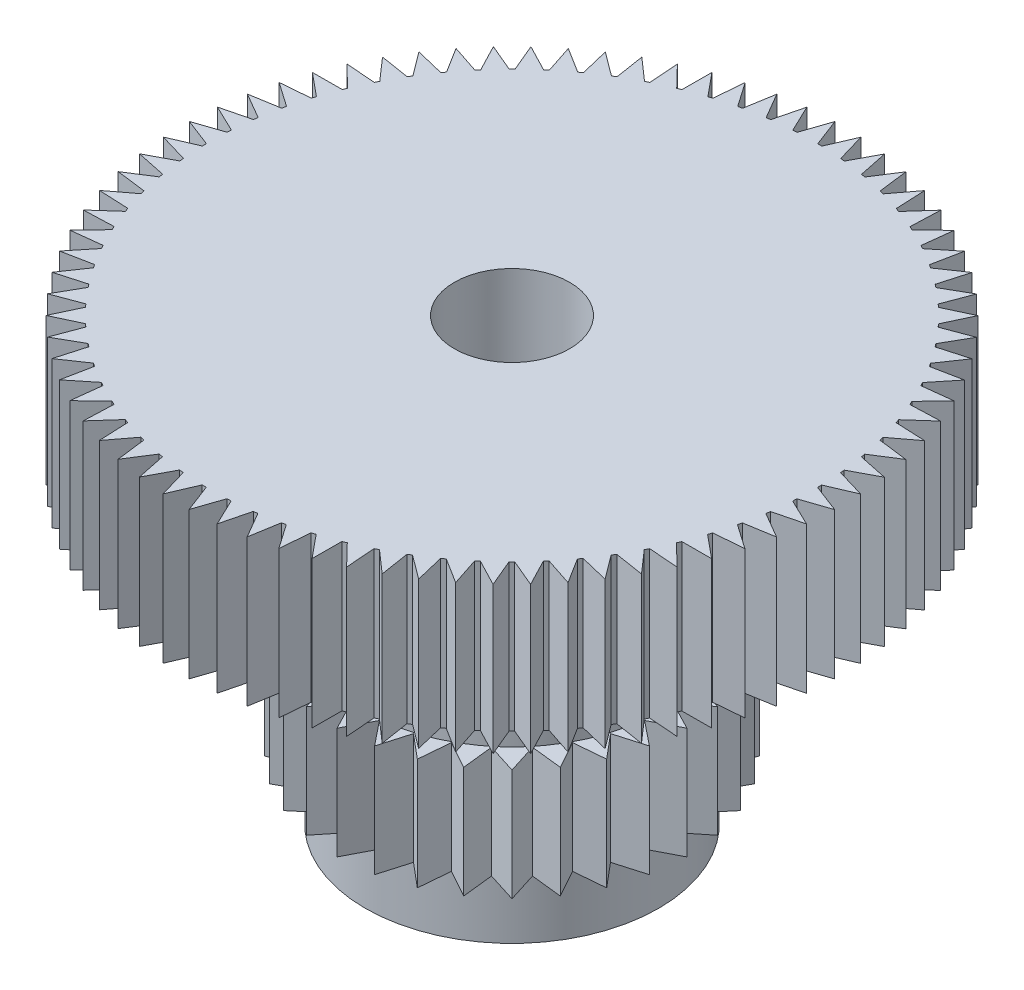
from build123d import *

# Parameters (mm, degrees)
SKETCH1_R           = 6.35
BOSS_EXTRUDE1_DEPTH = 12.7
SKETCH2_R           = 14.2875
BOSS_EXTRUDE2_DEPTH = 6.35
SKETCH3_R           = 2.494308135
CUT_EXTRUDE1_DEPTH  = 27.432
CUT_EXTRUDE5_START  = -7.366
SKETCH4_R           = 14.2875
CUT_EXTRUDE5_DEPTH  = 7.366
BOSS_EXTRUDE3_START = -2.54
SKETCH5_R           = 6.35
BOSS_EXTRUDE3_DEPTH = 4.826


with BuildPart() as part:
    # Sketch1 → Boss-Extrude1 (new body)
    with BuildSketch(Plane(origin=(0, 0, 0), x_dir=(1, 0, 0), z_dir=(0, 1, 0))):
        with Locations(Location((0, 0, 0), (0, 0, 270))):
            Circle(SKETCH1_R)
    extrude(amount=BOSS_EXTRUDE1_DEPTH)

    # Sketch2 → Boss-Extrude2 (add)
    with BuildSketch(Plane(origin=(0, 12.7, 0), x_dir=(1, 0, 0), z_dir=(0, 1, 0))):
        with Locations(Location((0, 0, 0), (0, 0, 270))):
            Circle(SKETCH2_R)
    extrude(amount=BOSS_EXTRUDE2_DEPTH)

    # Sketch3 → Cut-Extrude1 (cut)
    with BuildSketch(Plane.XZ):
        with Locations(Location((0, 0, 0), (0, 0, 270))):
            Circle(SKETCH3_R)
    extrude(amount=-CUT_EXTRUDE1_DEPTH, mode=Mode.SUBTRACT)

    # Sketch4 → Cut-Extrude5 (cut)
    with BuildSketch(Plane(origin=(0, 19.05, 0), x_dir=(1, 0, 0), z_dir=(0, 1, 0)).offset(CUT_EXTRUDE5_START)):
        Circle(SKETCH4_R)
        with BuildLine():
            Line((-0.695868842, 13.040502027), (-0.282374093, 14.260621109))
            Line((-0.282374093, 14.260621109), (0.179096678, 13.057827191))
            ThreePointArc((0.179096678, 13.057827191), (0.267410505, 13.056317176), (0.355712099, 13.054209875))
            Line((0.355712099, 13.054209875), (0.866044808, 14.237099983))
            Line((0.866044808, 14.237099983), (1.229234471, 13.001073386))
            ThreePointArc((1.229234471, 13.001073386), (1.317140418, 12.992461956), (1.40498611, 12.983256163))
            Line((1.40498611, 12.983256163), (2.008847076, 14.121245801))
            Line((2.008847076, 14.121245801), (2.271400208, 12.860002631))
            ThreePointArc((2.271400208, 12.860002631), (2.35832817, 12.844345636), (2.445148247, 12.828101053))
            Line((2.445148247, 12.828101053), (3.138621199, 13.913809921))
            Line((3.138621199, 13.913809921), (3.298835042, 12.635529824))
            ThreePointArc((3.298835042, 12.635529824), (3.38422126, 12.612928805), (3.46945266, 12.589750784))
            Line((3.46945266, 12.589750784), (4.24804016, 13.616137644))
            Line((4.24804016, 13.616137644), (4.304875665, 12.329110758))
            ThreePointArc((4.304875665, 12.329110758), (4.388166375, 12.299712291), (4.47125634, 12.269751151))
            Line((4.47125634, 12.269751151), (5.32990895, 13.23015949))
            Line((5.32990895, 13.23015949), (5.282997518, 11.942732677))
            ThreePointArc((5.282997518, 11.942732677), (5.363652548, 11.906727422), (5.444062208, 11.870177473))
            Line((5.444062208, 11.870177473), (6.377211235, 12.758378675))
            Line((6.377211235, 12.758378675), (6.226857105, 11.478901392))
            ThreePointArc((6.226857105, 11.478901392), (6.304353376, 11.436522858), (6.381561243, 11.393621139))
            Line((6.381561243, 11.393621139), (7.383154859, 12.203854878))
            Line((7.383154859, 12.203854878), (7.130333133, 10.940625027))
            ThreePointArc((7.130333133, 10.940625027), (7.204168053, 10.892148054), (7.277673405, 10.843172801))
            Line((7.277673405, 10.843172801), (8.341215889, 11.570184399))
            Line((8.341215889, 11.570184399), (7.987566216, 10.33139451))
            ThreePointArc((7.987566216, 10.33139451), (8.057260936, 10.277133491), (8.126587061, 10.222402325))
            Line((8.126587061, 10.222402325), (9.245180935, 10.861476835))
            Line((9.245180935, 10.861476835), (8.792996866, 9.655160935))
            ThreePointArc((8.792996866, 9.655160935), (8.858099389, 9.595467773), (8.922796683, 9.535335648))
            Line((8.922796683, 9.535335648), (10.089187434, 10.082328425))
            Line((10.089187434, 10.082328425), (9.541401557, 8.916309937))
            ThreePointArc((9.541401557, 8.916309937), (9.601489669, 8.851571764), (9.661138544, 8.78642866))
            Line((9.661138544, 8.78642866), (10.867761681, 9.237792247))
            Line((10.867761681, 9.237792247), (10.227926598, 8.119633247))
            ThreePointArc((10.227926598, 8.119633247), (10.282610605, 8.050269916), (10.336824214, 7.980538311))
            Line((10.336824214, 7.980538311), (11.575854323, 8.333345441))
            Line((11.575854323, 8.333345441), (10.848119611, 7.27029762))
            ThreePointArc((10.848119611, 7.27029762), (10.897044864, 7.196758979), (10.945471613, 7.122891109))
            Line((10.945471613, 7.122891109), (12.208873108, 7.374853692))
            Line((12.208873108, 7.374853692), (11.397958404, 6.373811323))
            ThreePointArc((11.397958404, 6.373811323), (11.440807606, 6.296574297), (11.483133428, 6.219049224))
            Line((11.483133428, 6.219049224), (12.762712666, 6.368533187))
            Line((12.762712666, 6.368533187), (11.873877064, 5.435988413))
            ThreePointArc((11.873877064, 5.435988413), (11.910372321, 5.355553916), (11.946322716, 5.274874418))
            Line((11.946322716, 5.274874418), (13.233781134, 5.320910301))
            Line((13.233781134, 5.320910301), (12.272789075, 4.462911033))
            ThreePointArc((12.272789075, 4.462911033), (12.302693701, 4.379800712), (12.332035517, 4.296490028))
            Line((12.332035517, 4.296490028), (13.619023454, 4.238779269))
            Line((13.619023454, 4.238779269), (12.592107339, 3.460889963))
            ThreePointArc((12.592107339, 3.460889963), (12.615227391, 3.37564282), (12.637770336, 3.290241252))
            Line((12.637770336, 3.290241252), (13.915941181, 3.129158127))
            Line((13.915941181, 3.129158127), (12.829760955, 2.436423692))
            ThreePointArc((12.829760955, 2.436423692), (12.84594649, 2.349592588), (12.861544365, 2.262653998))
            Line((12.861544365, 2.262653998), (14.122608689, 1.999243195))
            Line((14.122608689, 1.999243195), (12.984208648, 1.39615628))
            ThreePointArc((12.984208648, 1.39615628), (12.993354698, 1.308304348), (13.001906343, 1.220392565))
            Line((13.001906343, 1.220392565), (14.237685661, 0.856362402))
            Line((14.237685661, 0.856362402), (13.054448765, 0.346834258))
            ThreePointArc((13.054448765, 0.346834258), (13.056496014, 0.258531251), (13.057945969, 0.170216418))
            Line((13.057945969, 0.170216418), (14.260425778, -0.292072229))
            Line((14.260425778, -0.292072229), (13.040025773, -0.704737118))
            ThreePointArc((13.040025773, -0.704737118), (13.034960943, -0.79291852), (13.029299805, -0.881063648))
            Line((13.029299805, -0.881063648), (14.190681561, -1.438612659))
            Line((14.190681561, -1.438612659), (12.94103321, -1.751738002))
            ThreePointArc((12.94103321, -1.751738002), (12.928889149, -1.83922591), (12.916153632, -1.926629679))
            Line((12.916153632, -1.926629679), (14.028905329, -2.575823135))
            Line((14.028905329, -2.575823135), (12.75811308, -2.787378194))
            ThreePointArc((12.75811308, -2.787378194), (12.738968547, -2.873605214), (12.719241246, -2.959700776))
            Line((12.719241246, -2.959700776), (13.776146262, -3.696328409))
            Line((13.776146262, -3.696328409), (12.492451692, -3.804941168))
            ThreePointArc((12.492451692, -3.804941168), (12.466430846, -3.889348086), (12.4398397, -3.973577078))
            Line((12.4398397, -3.973577078), (13.434043601, -4.792861574))
            Line((13.434043601, -4.792861574), (12.14577196, -4.797827639))
            ThreePointArc((12.14577196, -4.797827639), (12.113043557, -4.879867043), (12.07976102, -4.961683208))
            Line((12.07976102, -4.961683208), (13.004816012, -5.858311194))
            Line((13.004816012, -5.858311194), (11.720322237, -5.759598356))
            ThreePointArc((11.720322237, -5.759598356), (11.681098532, -5.838738189), (11.641340455, -5.917610919))
            Line((11.641340455, -5.917610919), (12.491247201, -6.885767417))
            Line((12.491247201, -6.885767417), (11.218861727, -6.684015868))
            ThreePointArc((11.218861727, -6.684015868), (11.173397102, -6.759742878), (11.127421329, -6.835160652))
            Line((11.127421329, -6.835160652), (11.896667858, -7.868566796))
            Line((11.896667858, -7.868566796), (10.644642593, -7.565084972))
            ThreePointArc((10.644642593, -7.565084972), (10.593231903, -7.636908041), (10.541336606, -7.708381745))
            Line((10.541336606, -7.708381745), (11.224934059, -8.8003355))
            Line((11.224934059, -8.8003355), (10.001388867, -8.397091597))
            ThreePointArc((10.001388867, -8.397091597), (9.94436553, -8.464544924), (9.88688727, -8.531611024))
            Line((9.88688727, -8.531611024), (10.480402255, -9.675030652))
            Line((10.480402255, -9.675030652), (9.293272297, -9.174639861))
            ThreePointArc((9.293272297, -9.174639861), (9.231006131, -9.237285985), (9.168317677, -9.299509533))
            Line((9.168317677, -9.299509533), (9.667901021, -10.486979517))
            Line((9.667901021, -10.486979517), (8.524885289, -9.892687065))
            ThreePointArc((8.524885289, -9.892687065), (8.457780115, -9.950119702), (8.390288025, -10.007097153))
            Line((8.390288025, -10.007097153), (8.792699739, -11.230916295))
            Line((8.792699739, -11.230916295), (7.70121113, -10.546576397))
            ThreePointArc((7.70121113, -10.546576397), (7.62970215, -10.598423075), (7.557844135, -10.649784908))
            Line((7.557844135, -10.649784908), (7.860474426, -11.902016272))
            Line((7.860474426, -11.902016272), (6.827591661, -11.132067134))
            ThreePointArc((6.827591661, -11.132067134), (6.752142638, -11.177991607), (6.676384726, -11.223404722))
            Line((6.676384726, -11.223404722), (6.877270919, -12.495927106))
            Line((6.877270919, -12.495927106), (5.90969264, -11.645362144))
            ThreePointArc((5.90969264, -11.645362144), (5.83079289, -11.685066574), (5.751626401, -11.724236449))
            Line((5.751626401, -11.724236449), (5.849465671, -13.008797058))
            Line((5.849465671, -13.008797058), (4.953466994, -12.083132512))
            ThreePointArc((4.953466994, -12.083132512), (4.871628213, -12.1163594), (4.789566571, -12.149032004))
            Line((4.789566571, -12.149032004), (4.783724394, -13.437299969))
            Line((4.783724394, -13.437299969), (3.965116214, -12.442539129))
            ThreePointArc((3.965116214, -12.442539129), (3.880869158, -12.469072987), (3.796444563, -12.495036424))
            Line((3.796444563, -12.495036424), (3.686958829, -13.778656834))
            Line((3.686958829, -13.778656834), (2.951050135, -12.721251105))
            ThreePointArc((2.951050135, -12.721251105), (2.864941176, -12.74091985), (2.778701157, -12.760005739))
            Line((2.778701157, -12.760005739), (2.56628192, -14.030653821))
            Line((2.56628192, -14.030653821), (1.917845362, -12.917460886))
            ThreePointArc((1.917845362, -12.917460886), (1.830432952, -12.930136959), (1.742936806, -12.942221519))
            Line((1.742936806, -12.942221519), (1.428961689, -14.191656635))
            Line((1.428961689, -14.191656635), (0.872202627, -13.029895976))
            ThreePointArc((0.872202627, -13.029895976), (0.784053668, -13.035497168), (0.695868842, -13.040502027))
            Line((0.695868842, -13.040502027), (0.282374093, -14.260621109))
            Line((0.282374093, -14.260621109), (-0.179096678, -13.057827191))
            ThreePointArc((-0.179096678, -13.057827191), (-0.267410505, -13.056317176), (-0.355712099, -13.054209875))
            Line((-0.355712099, -13.054209875), (-0.866044808, -14.237099983))
            Line((-0.866044808, -14.237099983), (-1.229234471, -13.001073386))
            ThreePointArc((-1.229234471, -13.001073386), (-1.317140418, -12.992461956), (-1.40498611, -12.983256163))
            Line((-1.40498611, -12.983256163), (-2.008847076, -14.121245801))
            Line((-2.008847076, -14.121245801), (-2.271400208, -12.860002631))
            ThreePointArc((-2.271400208, -12.860002631), (-2.35832817, -12.844345636), (-2.445148247, -12.828101053))
            Line((-2.445148247, -12.828101053), (-3.138621199, -13.913809921))
            Line((-3.138621199, -13.913809921), (-3.298835042, -12.635529824))
            ThreePointArc((-3.298835042, -12.635529824), (-3.38422126, -12.612928805), (-3.46945266, -12.589750784))
            Line((-3.46945266, -12.589750784), (-4.24804016, -13.616137644))
            Line((-4.24804016, -13.616137644), (-4.304875665, -12.329110758))
            ThreePointArc((-4.304875665, -12.329110758), (-4.388166375, -12.299712291), (-4.47125634, -12.269751151))
            Line((-4.47125634, -12.269751151), (-5.32990895, -13.23015949))
            Line((-5.32990895, -13.23015949), (-5.282997518, -11.942732677))
            ThreePointArc((-5.282997518, -11.942732677), (-5.363652548, -11.906727422), (-5.444062208, -11.870177473))
            Line((-5.444062208, -11.870177473), (-6.377211235, -12.758378675))
            Line((-6.377211235, -12.758378675), (-6.226857105, -11.478901392))
            ThreePointArc((-6.226857105, -11.478901392), (-6.304353376, -11.436522858), (-6.381561243, -11.393621139))
            Line((-6.381561243, -11.393621139), (-7.383154859, -12.203854878))
            Line((-7.383154859, -12.203854878), (-7.130333133, -10.940625027))
            ThreePointArc((-7.130333133, -10.940625027), (-7.204168053, -10.892148054), (-7.277673405, -10.843172801))
            Line((-7.277673405, -10.843172801), (-8.341215889, -11.570184399))
            Line((-8.341215889, -11.570184399), (-7.987566216, -10.33139451))
            ThreePointArc((-7.987566216, -10.33139451), (-8.057260936, -10.277133491), (-8.126587061, -10.222402325))
            Line((-8.126587061, -10.222402325), (-9.245180935, -10.861476835))
            Line((-9.245180935, -10.861476835), (-8.792996866, -9.655160935))
            ThreePointArc((-8.792996866, -9.655160935), (-8.858099389, -9.595467773), (-8.922796683, -9.535335648))
            Line((-8.922796683, -9.535335648), (-10.089187434, -10.082328425))
            Line((-10.089187434, -10.082328425), (-9.541401557, -8.916309937))
            ThreePointArc((-9.541401557, -8.916309937), (-9.601489669, -8.851571764), (-9.661138544, -8.78642866))
            Line((-9.661138544, -8.78642866), (-10.867761681, -9.237792247))
            Line((-10.867761681, -9.237792247), (-10.227926598, -8.119633247))
            ThreePointArc((-10.227926598, -8.119633247), (-10.282610605, -8.050269916), (-10.336824214, -7.980538311))
            Line((-10.336824214, -7.980538311), (-11.575854323, -8.333345441))
            Line((-11.575854323, -8.333345441), (-10.848119611, -7.27029762))
            ThreePointArc((-10.848119611, -7.27029762), (-10.897044864, -7.196758979), (-10.945471613, -7.122891109))
            Line((-10.945471613, -7.122891109), (-12.208873108, -7.374853692))
            Line((-12.208873108, -7.374853692), (-11.397958404, -6.373811323))
            ThreePointArc((-11.397958404, -6.373811323), (-11.440807606, -6.296574297), (-11.483133428, -6.219049224))
            Line((-11.483133428, -6.219049224), (-12.762712666, -6.368533187))
            Line((-12.762712666, -6.368533187), (-11.873877064, -5.435988413))
            ThreePointArc((-11.873877064, -5.435988413), (-11.910372321, -5.355553916), (-11.946322716, -5.274874418))
            Line((-11.946322716, -5.274874418), (-13.233781134, -5.320910301))
            Line((-13.233781134, -5.320910301), (-12.272789075, -4.462911033))
            ThreePointArc((-12.272789075, -4.462911033), (-12.302693701, -4.379800712), (-12.332035517, -4.296490028))
            Line((-12.332035517, -4.296490028), (-13.619023454, -4.238779269))
            Line((-13.619023454, -4.238779269), (-12.592107339, -3.460889963))
            ThreePointArc((-12.592107339, -3.460889963), (-12.615227391, -3.37564282), (-12.637770336, -3.290241252))
            Line((-12.637770336, -3.290241252), (-13.915941181, -3.129158127))
            Line((-13.915941181, -3.129158127), (-12.829760955, -2.436423692))
            ThreePointArc((-12.829760955, -2.436423692), (-12.84594649, -2.349592588), (-12.861544365, -2.262653998))
            Line((-12.861544365, -2.262653998), (-14.122608689, -1.999243195))
            Line((-14.122608689, -1.999243195), (-12.984208648, -1.39615628))
            ThreePointArc((-12.984208648, -1.39615628), (-12.993354698, -1.308304348), (-13.001906343, -1.220392565))
            Line((-13.001906343, -1.220392565), (-14.237685661, -0.856362402))
            Line((-14.237685661, -0.856362402), (-13.054448765, -0.346834258))
            ThreePointArc((-13.054448765, -0.346834258), (-13.056496014, -0.258531251), (-13.057945969, -0.170216418))
            Line((-13.057945969, -0.170216418), (-14.260425778, 0.292072229))
            Line((-14.260425778, 0.292072229), (-13.040025773, 0.704737118))
            ThreePointArc((-13.040025773, 0.704737118), (-13.034960943, 0.79291852), (-13.029299805, 0.881063648))
            Line((-13.029299805, 0.881063648), (-14.190681561, 1.438612659))
            Line((-14.190681561, 1.438612659), (-12.94103321, 1.751738002))
            ThreePointArc((-12.94103321, 1.751738002), (-12.928889149, 1.83922591), (-12.916153632, 1.926629679))
            Line((-12.916153632, 1.926629679), (-14.028905329, 2.575823135))
            Line((-14.028905329, 2.575823135), (-12.75811308, 2.787378194))
            ThreePointArc((-12.75811308, 2.787378194), (-12.738968547, 2.873605214), (-12.719241246, 2.959700776))
            Line((-12.719241246, 2.959700776), (-13.776146262, 3.696328409))
            Line((-13.776146262, 3.696328409), (-12.492451692, 3.804941168))
            ThreePointArc((-12.492451692, 3.804941168), (-12.466430846, 3.889348086), (-12.4398397, 3.973577078))
            Line((-12.4398397, 3.973577078), (-13.434043601, 4.792861574))
            Line((-13.434043601, 4.792861574), (-12.14577196, 4.797827639))
            ThreePointArc((-12.14577196, 4.797827639), (-12.113043557, 4.879867043), (-12.07976102, 4.961683208))
            Line((-12.07976102, 4.961683208), (-13.004816012, 5.858311194))
            Line((-13.004816012, 5.858311194), (-11.720322237, 5.759598356))
            ThreePointArc((-11.720322237, 5.759598356), (-11.681098532, 5.838738189), (-11.641340455, 5.917610919))
            Line((-11.641340455, 5.917610919), (-12.491247201, 6.885767417))
            Line((-12.491247201, 6.885767417), (-11.218861727, 6.684015868))
            ThreePointArc((-11.218861727, 6.684015868), (-11.173397102, 6.759742878), (-11.127421329, 6.835160652))
            Line((-11.127421329, 6.835160652), (-11.896667858, 7.868566796))
            Line((-11.896667858, 7.868566796), (-10.644642593, 7.565084972))
            ThreePointArc((-10.644642593, 7.565084972), (-10.593231903, 7.636908041), (-10.541336606, 7.708381745))
            Line((-10.541336606, 7.708381745), (-11.224934059, 8.8003355))
            Line((-11.224934059, 8.8003355), (-10.001388867, 8.397091597))
            ThreePointArc((-10.001388867, 8.397091597), (-9.94436553, 8.464544924), (-9.88688727, 8.531611024))
            Line((-9.88688727, 8.531611024), (-10.480402255, 9.675030652))
            Line((-10.480402255, 9.675030652), (-9.293272297, 9.174639861))
            ThreePointArc((-9.293272297, 9.174639861), (-9.231006131, 9.237285985), (-9.168317677, 9.299509533))
            Line((-9.168317677, 9.299509533), (-9.667901021, 10.486979517))
            Line((-9.667901021, 10.486979517), (-8.524885289, 9.892687065))
            ThreePointArc((-8.524885289, 9.892687065), (-8.457780115, 9.950119702), (-8.390288025, 10.007097153))
            Line((-8.390288025, 10.007097153), (-8.792699739, 11.230916295))
            Line((-8.792699739, 11.230916295), (-7.70121113, 10.546576397))
            ThreePointArc((-7.70121113, 10.546576397), (-7.62970215, 10.598423075), (-7.557844135, 10.649784908))
            Line((-7.557844135, 10.649784908), (-7.860474426, 11.902016272))
            Line((-7.860474426, 11.902016272), (-6.827591661, 11.132067134))
            ThreePointArc((-6.827591661, 11.132067134), (-6.752142638, 11.177991607), (-6.676384726, 11.223404722))
            Line((-6.676384726, 11.223404722), (-6.877270919, 12.495927106))
            Line((-6.877270919, 12.495927106), (-5.90969264, 11.645362144))
            ThreePointArc((-5.90969264, 11.645362144), (-5.83079289, 11.685066574), (-5.751626401, 11.724236449))
            Line((-5.751626401, 11.724236449), (-5.849465671, 13.008797058))
            Line((-5.849465671, 13.008797058), (-4.953466994, 12.083132512))
            ThreePointArc((-4.953466994, 12.083132512), (-4.871628213, 12.1163594), (-4.789566571, 12.149032004))
            Line((-4.789566571, 12.149032004), (-4.783724394, 13.437299969))
            Line((-4.783724394, 13.437299969), (-3.965116214, 12.442539129))
            ThreePointArc((-3.965116214, 12.442539129), (-3.880869158, 12.469072987), (-3.796444563, 12.495036424))
            Line((-3.796444563, 12.495036424), (-3.686958829, 13.778656834))
            Line((-3.686958829, 13.778656834), (-2.951050135, 12.721251105))
            ThreePointArc((-2.951050135, 12.721251105), (-2.864941176, 12.74091985), (-2.778701157, 12.760005739))
            Line((-2.778701157, 12.760005739), (-2.56628192, 14.030653821))
            Line((-2.56628192, 14.030653821), (-1.917845362, 12.917460886))
            ThreePointArc((-1.917845362, 12.917460886), (-1.830432952, 12.930136959), (-1.742936806, 12.942221519))
            Line((-1.742936806, 12.942221519), (-1.428961689, 14.191656635))
            Line((-1.428961689, 14.191656635), (-0.872202627, 13.029895976))
            ThreePointArc((-0.872202627, 13.029895976), (-0.784053668, 13.035497168), (-0.695868842, 13.040502027))
        make_face(mode=Mode.SUBTRACT)
    extrude(amount=CUT_EXTRUDE5_DEPTH, mode=Mode.SUBTRACT)

    # Sketch5 → Boss-Extrude3 (add)
    with BuildSketch(Plane.XZ.offset(BOSS_EXTRUDE3_START)):
        Polygon((-1.856744187, -6.120865291), (-1.477036249, -7.425562667), (-0.626945787, -6.365487402), (0, -7.57103804), (0.626945787, -6.365487402), (1.477036249, -7.425562667), (1.856744187, -6.120865291), (2.897310824, -6.994727085), (3.015188948, -5.641021759), (4.206243368, -6.295088064), (4.05776169, -4.944396925), (5.353532339, -5.353532339), (4.944396925, -4.05776169), (6.295088064, -4.206243368), (5.641021759, -3.015188948), (6.994727085, -2.897310824), (6.120865291, -1.856744187), (7.425562667, -1.477036249), (6.365487402, -0.626945787), (7.57103804, 0), (6.365487402, 0.626945787), (7.425562667, 1.477036249), (6.120865291, 1.856744187), (6.994727085, 2.897310824), (5.641021759, 3.015188948), (6.295088064, 4.206243368), (4.944396925, 4.05776169), (5.353532339, 5.353532339), (4.05776169, 4.944396925), (4.206243368, 6.295088064), (3.015188948, 5.641021759), (2.897310824, 6.994727085), (1.856744187, 6.120865291), (1.477036249, 7.425562667), (0.626945787, 6.365487402), (0, 7.57103804), (-0.626945787, 6.365487402), (-1.477036249, 7.425562667), (-1.856744187, 6.120865291), (-2.897310824, 6.994727085), (-3.015188948, 5.641021759), (-4.206243368, 6.295088064), (-4.05776169, 4.944396925), (-5.353532339, 5.353532339), (-4.944396925, 4.05776169), (-6.295088064, 4.206243368), (-5.641021759, 3.015188948), (-6.994727085, 2.897310824), (-6.120865291, 1.856744187), (-7.425562667, 1.477036249), (-6.365487402, 0.626945787), (-7.57103804, 0), (-6.365487402, -0.626945787), (-7.425562667, -1.477036249), (-6.120865291, -1.856744187), (-6.994727085, -2.897310824), (-5.641021759, -3.015188948), (-6.295088064, -4.206243368), (-4.944396925, -4.05776169), (-5.353532339, -5.353532339), (-4.05776169, -4.944396925), (-4.206243368, -6.295088064), (-3.015188948, -5.641021759), (-2.897310824, -6.994727085), align=None)
        Circle(SKETCH5_R, mode=Mode.SUBTRACT)
    extrude(amount=-BOSS_EXTRUDE3_DEPTH)


solid = part.part
